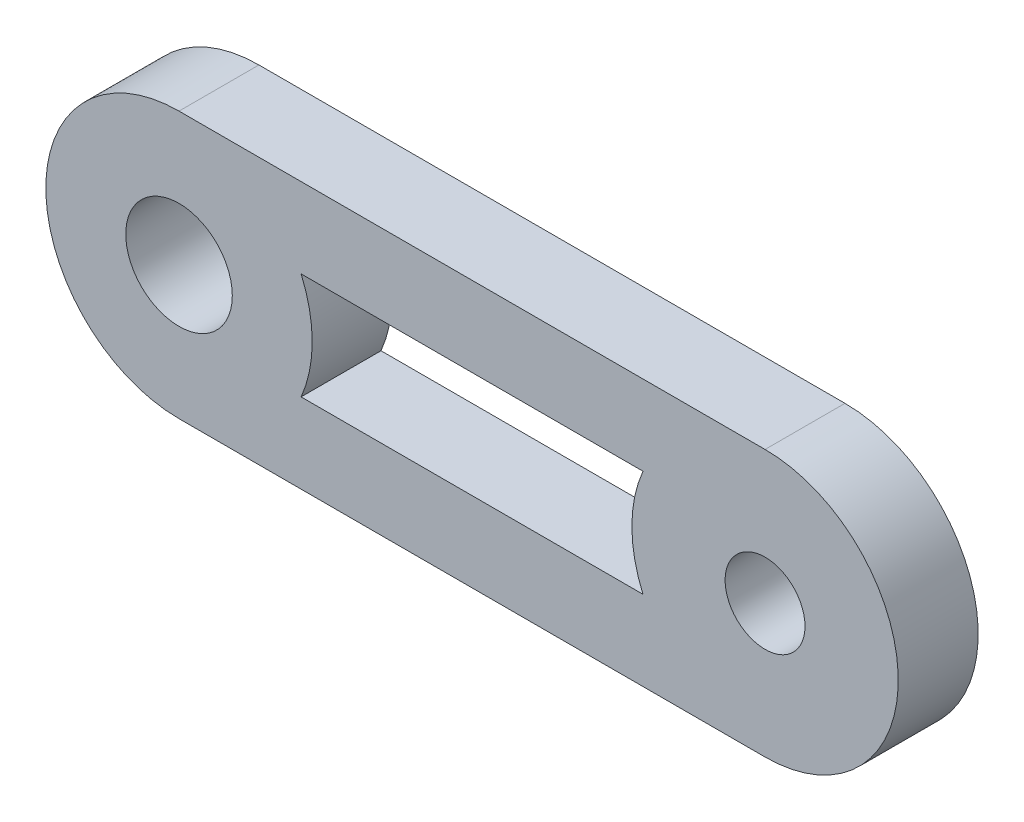
from build123d import *

# Parameters (mm, degrees)
SKETCH1_R          = 1.5
EXTRUDE1_DEPTH     = 3
CUT_EXTRUDE1_START = -10
SKETCH2_R          = 2
CUT_EXTRUDE1_DEPTH = 10


with BuildPart() as part:
    # Sketch1 → Extrude1 (new body)
    with BuildSketch(Plane.XY):
        with BuildLine():
            ThreePointArc((0, 5), (-5, 0), (0, -5))
            Line((0, -5), (22, -5))
            ThreePointArc((22, -5), (27, 0), (22, 5))
            Line((22, 5), (0, 5))
        make_face()
        Circle(SKETCH1_R, mode=Mode.SUBTRACT)
        with BuildLine():
            ThreePointArc((23.5, 0), (22, -1.5), (20.5, 0))
            ThreePointArc((20.5, 0), (22, 1.5), (23.5, 0))
        make_face(mode=Mode.SUBTRACT)
    extrude(amount=EXTRUDE1_DEPTH)

    # Sketch2 → Cut-Extrude1 (cut)
    with BuildSketch(Plane.XY.offset(3).offset(CUT_EXTRUDE1_START)):
        Circle(SKETCH2_R)
        with BuildLine():
            Line((4.582575695, -2), (17.417424305, -2))
            ThreePointArc((17.417424305, -2), (17, 0), (17.417424305, 2))
            Line((17.417424305, 2), (4.582575695, 2))
            ThreePointArc((4.582575695, 2), (5, 0), (4.582575695, -2))
        make_face()
    extrude(amount=CUT_EXTRUDE1_DEPTH, mode=Mode.SUBTRACT)


solid = part.part
